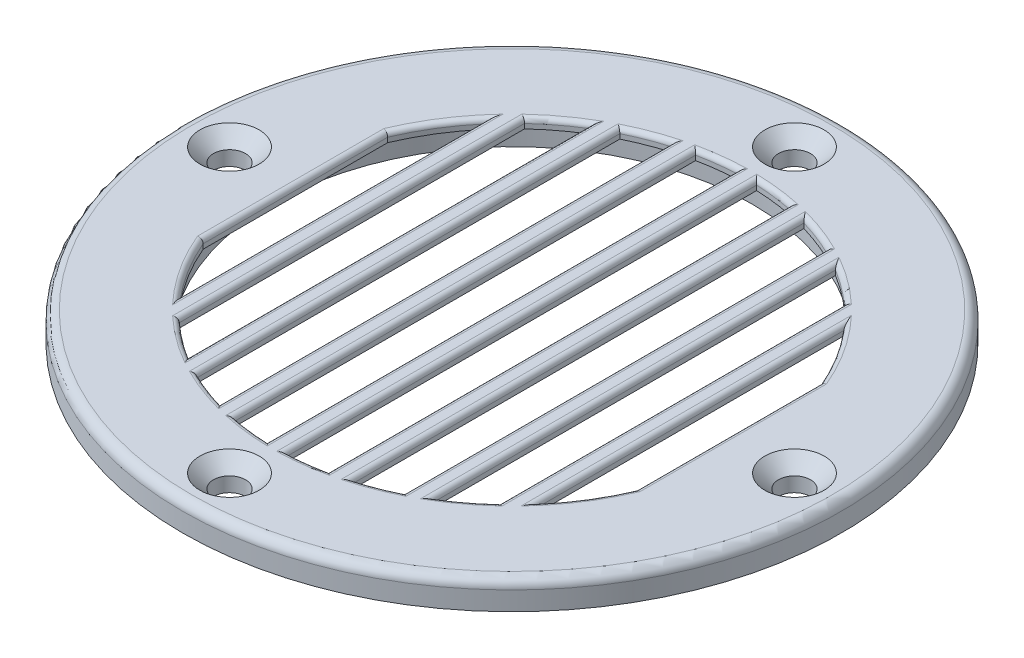
from build123d import *

# Parameters (mm, degrees)
SKETCH1_R                                      = 35
BOSS_EXTRUDE1_DEPTH                            = 3
CSK_FOR_M3_FLAT_HEAD_MACHINE_SCREW1_AT_2_COUNT = 2
CSK_FOR_M3_FLAT_HEAD_MACHINE_SCREW1_AT_2_PITCH = 42.426406871
CSK_FOR_M3_FLAT_HEAD_MACHINE_SCREW1_AT_3_COUNT = 2
CSK_FOR_M3_FLAT_HEAD_MACHINE_SCREW1_AT_3_PITCH = 60
CSK_FOR_M3_FLAT_HEAD_MACHINE_SCREW1_AT_4_COUNT = 2
CSK_FOR_M3_FLAT_HEAD_MACHINE_SCREW1_AT_4_PITCH = 42.426406871
FILLET1_R                                      = 1
FILLET3_R                                      = 0.5
SKETCH5_R                                      = 25.5
CUT_EXTRUDE1_DEPTH                             = 2


with BuildPart() as part:
    # Sketch1 → Boss-Extrude1 (new body)
    with BuildSketch(Plane(origin=(0, 0, 0), x_dir=(1, 0, 0), z_dir=(0, 1, 0))):
        with Locations(Location((0, 0, 0), (0, 0, 270))):
            Circle(SKETCH1_R)
        with BuildLine():
            ThreePointArc((-17, -18.33030278), (-15.07600487, -19.942770047), (-13, -21.354156504))
            Line((-13, -21.354156504), (-13, 21.354156504))
            ThreePointArc((-13, 21.354156504), (-15.07600487, 19.942770047), (-17, 18.33030278))
            Line((-17, 18.33030278), (-17, -18.33030278))
        make_face(mode=Mode.SUBTRACT)
        with BuildLine():
            ThreePointArc((-11, -22.449944321), (-9.033308815, -23.310927306), (-7, -24))
            Line((-7, -24), (-7, 24))
            ThreePointArc((-7, 24), (-9.033308815, 23.310927306), (-11, 22.449944321))
            Line((-11, 22.449944321), (-11, -22.449944321))
        make_face(mode=Mode.SUBTRACT)
        with BuildLine():
            ThreePointArc((-5, -24.494897428), (-3.009788894, -24.818162116), (-1, -24.979991994))
            Line((-1, -24.979991994), (-1, 24.979991994))
            ThreePointArc((-1, 24.979991994), (-3.009788894, 24.818162116), (-5, 24.494897428))
            Line((-5, 24.494897428), (-5, -24.494897428))
        make_face(mode=Mode.SUBTRACT)
        with BuildLine():
            ThreePointArc((1, -24.979991994), (3.009788894, -24.818162116), (5, -24.494897428))
            Line((5, -24.494897428), (5, 24.494897428))
            ThreePointArc((5, 24.494897428), (3.009788894, 24.818162116), (1, 24.979991994))
            Line((1, 24.979991994), (1, -24.979991994))
        make_face(mode=Mode.SUBTRACT)
        with BuildLine():
            ThreePointArc((7, -24), (9.033308815, -23.310927306), (11, -22.449944321))
            Line((11, -22.449944321), (11, 22.449944321))
            ThreePointArc((11, 22.449944321), (9.033308815, 23.310927306), (7, 24))
            Line((7, 24), (7, -24))
        make_face(mode=Mode.SUBTRACT)
        with BuildLine():
            ThreePointArc((13, -21.354156504), (15.07600487, -19.942770047), (17, -18.33030278))
            Line((17, -18.33030278), (17, 18.33030278))
            ThreePointArc((17, 18.33030278), (15.07600487, 19.942770047), (13, 21.354156504))
            Line((13, 21.354156504), (13, -21.354156504))
        make_face(mode=Mode.SUBTRACT)
        with BuildLine():
            ThreePointArc((19, -16.248076809), (21.246199779, -13.175697134), (23, -9.797958971))
            Line((23, -9.797958971), (23, 9.797958971))
            ThreePointArc((23, 9.797958971), (21.246199779, 13.175697134), (19, 16.248076809))
            Line((19, 16.248076809), (19, -16.248076809))
        make_face(mode=Mode.SUBTRACT)
        with BuildLine():
            ThreePointArc((-23, -9.797958971), (-21.246199779, -13.175697134), (-19, -16.248076809))
            Line((-19, -16.248076809), (-19, 16.248076809))
            ThreePointArc((-19, 16.248076809), (-21.246199779, 13.175697134), (-23, 9.797958971))
            Line((-23, 9.797958971), (-23, -9.797958971))
        make_face(mode=Mode.SUBTRACT)
    extrude(amount=BOSS_EXTRUDE1_DEPTH)

    # Sketch4 → CSK for M3 Flat Head Machine Screw1 (revolve, cut)
    with BuildSketch(Plane(origin=(30, 3, 0), x_dir=(0, 0, 1), z_dir=(1, 0, 0))):
        Polygon((0, 0), (0, 3), (1.7, 3), (1.7, 1.45), (3.15, 0), align=None)
    csk_for_m3_flat_head_machine_screw1 = revolve(axis=Axis((30, 9.35, 0), (0, -1, 0)), mode=Mode.SUBTRACT)

    # CSK for M3 Flat Head Machine Screw1 at 2: CSK for M3 Flat Head Machine Screw1 ×2
    with Locations(*[Vector(-0.7071067811865487, 0, 0.7071067811865464) * (i * CSK_FOR_M3_FLAT_HEAD_MACHINE_SCREW1_AT_2_PITCH) for i in range(1, CSK_FOR_M3_FLAT_HEAD_MACHINE_SCREW1_AT_2_COUNT)]):
        add(csk_for_m3_flat_head_machine_screw1, mode=Mode.SUBTRACT)

    # CSK for M3 Flat Head Machine Screw1 at 3: CSK for M3 Flat Head Machine Screw1 ×2
    with Locations(*[(-i * CSK_FOR_M3_FLAT_HEAD_MACHINE_SCREW1_AT_3_PITCH, 0, 0) for i in range(1, CSK_FOR_M3_FLAT_HEAD_MACHINE_SCREW1_AT_3_COUNT)]):
        add(csk_for_m3_flat_head_machine_screw1, mode=Mode.SUBTRACT)

    # CSK for M3 Flat Head Machine Screw1 at 4: CSK for M3 Flat Head Machine Screw1 ×2
    with Locations(*[Vector(-0.7071067811865464, 0, -0.7071067811865487) * (i * CSK_FOR_M3_FLAT_HEAD_MACHINE_SCREW1_AT_4_PITCH) for i in range(1, CSK_FOR_M3_FLAT_HEAD_MACHINE_SCREW1_AT_4_COUNT)]):
        add(csk_for_m3_flat_head_machine_screw1, mode=Mode.SUBTRACT)

    # Fillet1
    fillet1_edges = [part.edges().sort_by_distance(p)[0] for p in [
        (0, 3, -35),
    ]]
    fillet(fillet1_edges, radius=FILLET1_R)

    # Fillet3
    fillet3_edges = [part.edges().sort_by_distance(p)[0] for p in [
        (15.07600487, 3, -19.942770047),
        (17, 3, 0),
        (21.246199779, 3, 13.175697134),
        (19, 3, 0),
        (21.246199779, 3, -13.175697134),
        (23, 3, 0),
        (-21.246199779, 3, 13.175697134),
        (-23, 3, 0),
        (-15.07600487, 3, 19.942770047),
        (-21.246199779, 3, -13.175697134),
        (-19, 3, 0),
        (-17, 3, 0),
        (-15.07600487, 3, -19.942770047),
        (-13, 3, 0),
        (-9.033308815, 3, 23.310927306),
        (-11, 3, 0),
        (-9.033308815, 3, -23.310927306),
        (-7, 3, 0),
        (-3.009788894, 3, 24.818162116),
        (-5, 3, 0),
        (-3.009788894, 3, -24.818162116),
        (-1, 3, 0),
        (3.009788894, 3, 24.818162116),
        (1, 3, 0),
        (3.009788894, 3, -24.818162116),
        (5, 3, 0),
        (9.033308815, 3, 23.310927306),
        (7, 3, 0),
        (9.033308815, 3, -23.310927306),
        (11, 3, 0),
        (15.07600487, 3, 19.942770047),
        (13, 3, 0),
    ]]
    fillet(fillet3_edges, radius=FILLET3_R - 0.0001)  # a hair under: the kernel refuses the full size

    # Sketch5 → Cut-Extrude1 (cut)
    with BuildSketch(Plane.XZ):
        with Locations(Location((0, 0, 0), (0, 0, 270))):
            Circle(SKETCH5_R)
    extrude(amount=-CUT_EXTRUDE1_DEPTH, mode=Mode.SUBTRACT)


solid = part.part
